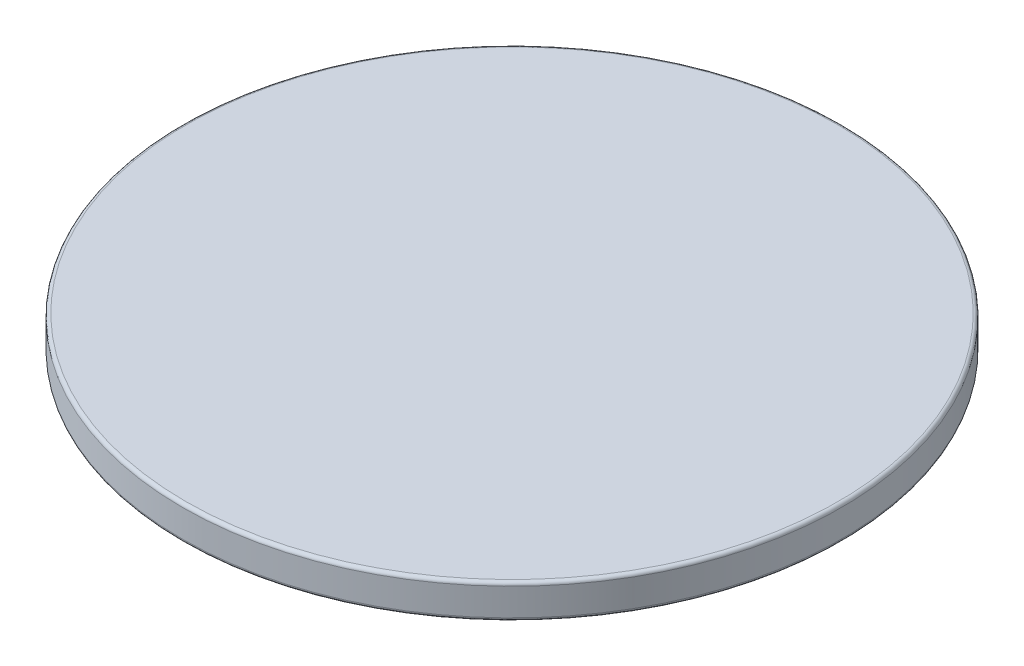
from build123d import *

# Parameters (mm, degrees)
SKETCH2_R           = 61.214
BOSS_EXTRUDE1_DEPTH = 6.35
FILLET1_R           = 0.635


with BuildPart() as part:
    # Sketch2 → Boss-Extrude1 (new body)
    with BuildSketch(Plane(origin=(0, 0, 0), x_dir=(1, 0, 0), z_dir=(0, 1, 0))):
        Circle(SKETCH2_R)
    extrude(amount=BOSS_EXTRUDE1_DEPTH)

    # Fillet1
    fillet1_edges = [part.edges().sort_by_distance(p)[0] for p in [
        (-61.214, 0, 0),
        (-61.214, 6.35, 0),
    ]]
    fillet(fillet1_edges, radius=FILLET1_R)


solid = part.part
